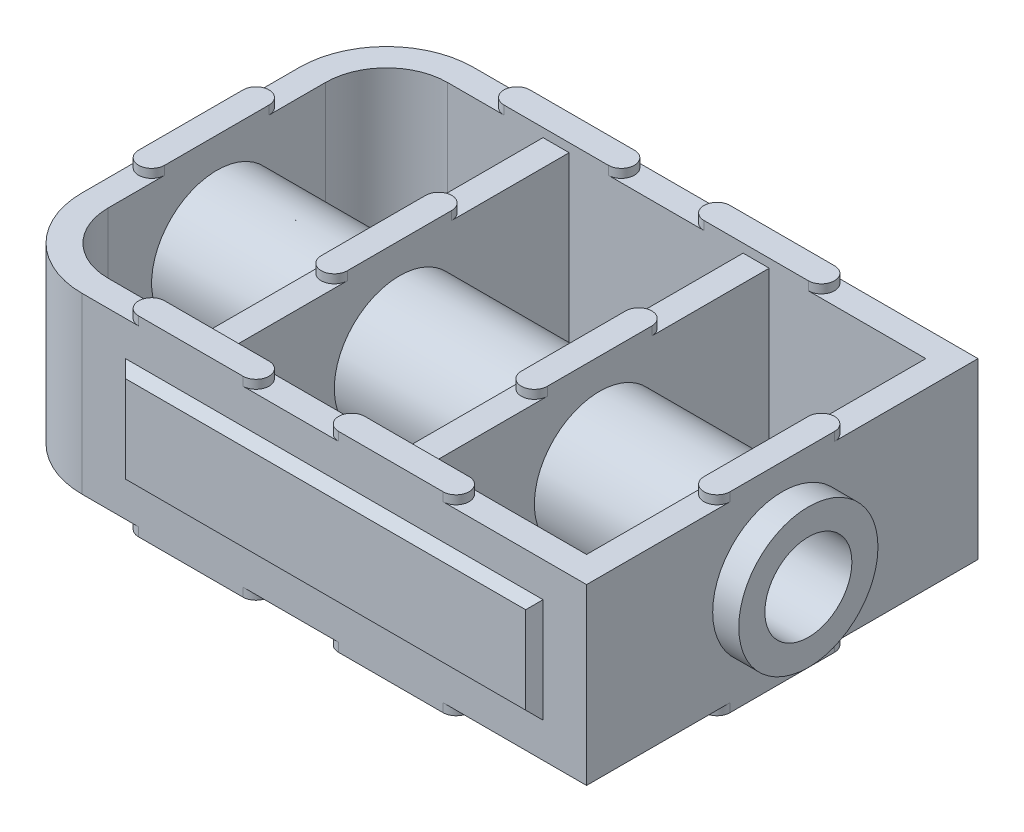
from build123d import *

# Parameters (mm, degrees)
SKETCH1_W                = 18
SKETCH1_H                = 39
SKETCH1_W_2              = 20
BOSS_EXTRUDE1_DEPTH      = 10
BOSS_EXTRUDE3_REACH      = 74.32
SKETCH3_R                = 7.5
SKETCH4_R                = 5
CUT_EXTRUDE1_DEPTH       = 68
CUT_EXTRUDE2_DEPTH       = 5
BOSS_EXTRUDE4_START      = 3
SKETCH6_R                = 8
SKETCH6_R_2              = 5
BOSS_EXTRUDE4_DEPTH      = 3
BOSS_EXTRUDE5_DEPTH      = 1
SKETCH8_W                = 48
SKETCH8_H                = 12
BOSS_EXTRUDE6_DEPTH      = 1
CHAMFER1_SIZE            = 1
CHAMFER1_OF_MIRROR2_SIZE = 1


with BuildPart() as part:
    # Sketch1 → Boss-Extrude1 (new, symmetric)
    with BuildSketch(Plane(origin=(0, 0, 0), x_dir=(1, 0, 0), z_dir=(0, 1, 0))):
        with BuildLine():
            Line((0, -22.5), (-58, -22.5))
            ThreePointArc((-58, -22.5), (-65.071067812, -19.571067812), (-68, -12.5))
            Line((-68, -12.5), (-68, 12.5))
            ThreePointArc((-68, 12.5), (-65.071067812, 19.571067812), (-58, 22.5))
            Line((-58, 22.5), (0, 22.5))
            Line((0, 22.5), (0, -22.5))
        make_face()
        with Locations((-12, 0)):
            Rectangle(SKETCH1_W, SKETCH1_H, mode=Mode.SUBTRACT)
        with BuildLine():
            Line((-65, -12.5), (-65, 12.5))
            ThreePointArc((-65, 12.5), (-62.949747468, 17.449747468), (-58, 19.5))
            Line((-58, 19.5), (-47, 19.5))
            Line((-47, 19.5), (-47, -19.5))
            Line((-47, -19.5), (-58, -19.5))
            ThreePointArc((-58, -19.5), (-62.949747468, -17.449747468), (-65, -12.5))
        make_face(mode=Mode.SUBTRACT)
        with Locations((-34, 0)):
            Rectangle(SKETCH1_W_2, SKETCH1_H, mode=Mode.SUBTRACT)
    extrude(amount=BOSS_EXTRUDE1_DEPTH, both=True)

    # Boss-Extrude3: up to this face of the body (flat: up to its plane)
    boss_extrude3_end = Plane(part.part.faces().sort_by_distance((-65, 0, 0))[0])
    # Sketch3 → Boss-Extrude3 (add, up to the picked face)
    with BuildSketch(Plane(origin=(0, 0, 0), x_dir=(0, 0, -1), z_dir=(1, 0, 0)), mode=Mode.PRIVATE) as boss_extrude3_sk1:
        Circle(SKETCH3_R)
    boss_extrude3_tool1 = split(extrude(boss_extrude3_sk1.sketch, amount=-BOSS_EXTRUDE3_REACH, mode=Mode.PRIVATE), bisect_by=boss_extrude3_end, keep=Keep.BOTH, mode=Mode.PRIVATE)
    add(boss_extrude3_tool1.solids().sort_by(Axis((0, 0, 0), (-1, 0, 0)))[0])

    # Sketch4 → Cut-Extrude1 (cut)
    with BuildSketch(Plane(origin=(0, 0, 0), x_dir=(0, 0, -1), z_dir=(1, 0, 0))):
        Circle(SKETCH4_R)
    extrude(amount=-CUT_EXTRUDE1_DEPTH, mode=Mode.SUBTRACT)

    # Sketch5 → Cut-Extrude2 (cut)
    with BuildSketch(Plane.ZY.offset(68)):
        Polygon((3.464101615, 6), (-3.464101615, 6), (-6.92820323, 0), (-3.464101615, -6), (3.464101615, -6), (6.92820323, 0), align=None)
    extrude(amount=-CUT_EXTRUDE2_DEPTH, mode=Mode.SUBTRACT)

    # Sketch6 → Boss-Extrude4 (add)
    with BuildSketch(Plane(origin=(0, 0, 0), x_dir=(0, 0, -1), z_dir=(1, 0, 0)).offset(BOSS_EXTRUDE4_START)):
        with Locations(Location((0, 0, 0), (0, 0, 180))):
            Circle(SKETCH6_R)
        Circle(SKETCH6_R_2, mode=Mode.SUBTRACT)
    extrude(amount=-BOSS_EXTRUDE4_DEPTH)

    # Sketch7 → Boss-Extrude5 (add)
    with BuildSketch(Plane(origin=(0, 10, 0), x_dir=(1, 0, 0), z_dir=(0, 1, 0))):
        with BuildLine():
            Line((-16.5, 19.5), (-28.5, 19.5))
            ThreePointArc((-28.5, 19.5), (-30, 21), (-28.5, 22.5))
            Line((-28.5, 22.5), (-16.5, 22.5))
            ThreePointArc((-16.5, 22.5), (-15, 21), (-16.5, 19.5))
        make_face()
        with BuildLine():
            Line((-51.5, 22.5), (-39.5, 22.5))
            ThreePointArc((-39.5, 22.5), (-38, 21), (-39.5, 19.5))
            Line((-39.5, 19.5), (-51.5, 19.5))
            ThreePointArc((-51.5, 19.5), (-53, 21), (-51.5, 22.5))
        make_face()
        with BuildLine():
            Line((-16.5, -19.5), (-28.5, -19.5))
            ThreePointArc((-28.5, -19.5), (-30, -21), (-28.5, -22.5))
            Line((-28.5, -22.5), (-16.5, -22.5))
            ThreePointArc((-16.5, -22.5), (-15, -21), (-16.5, -19.5))
        make_face()
        with BuildLine():
            Line((-51.5, -22.5), (-39.5, -22.5))
            ThreePointArc((-39.5, -22.5), (-38, -21), (-39.5, -19.5))
            Line((-39.5, -19.5), (-51.5, -19.5))
            ThreePointArc((-51.5, -19.5), (-53, -21), (-51.5, -22.5))
        make_face()
        with BuildLine():
            Line((-68, -6), (-68, 6))
            ThreePointArc((-68, 6), (-66.5, 7.5), (-65, 6))
            Line((-65, 6), (-65, -6))
            ThreePointArc((-65, -6), (-66.5, -7.5), (-68, -6))
        make_face()
        with BuildLine():
            Line((-24, -6), (-24, 6))
            ThreePointArc((-24, 6), (-22.5, 7.5), (-21, 6))
            Line((-21, 6), (-21, -6))
            ThreePointArc((-21, -6), (-22.5, -7.5), (-24, -6))
        make_face()
        with BuildLine():
            Line((-47, -6), (-47, 6))
            ThreePointArc((-47, 6), (-45.5, 7.5), (-44, 6))
            Line((-44, 6), (-44, -6))
            ThreePointArc((-44, -6), (-45.5, -7.5), (-47, -6))
        make_face()
        with BuildLine():
            Line((-3, -6), (-3, 6))
            ThreePointArc((-3, 6), (-1.5, 7.5), (0, 6))
            Line((0, 6), (0, -6))
            ThreePointArc((0, -6), (-1.5, -7.5), (-3, -6))
        make_face()
    boss_extrude5 = extrude(amount=BOSS_EXTRUDE5_DEPTH)

    # Mirror1: Boss-Extrude5 across plane
    add(boss_extrude5.mirror(Plane.ZX))

    # Sketch8 → Boss-Extrude6 (add)
    with BuildSketch(Plane.XY.offset(22.5)):
        with Locations((-29, 0)):
            Rectangle(SKETCH8_W, SKETCH8_H)
    boss_extrude6 = extrude(amount=BOSS_EXTRUDE6_DEPTH)

    # Chamfer1
    chamfer1_edges = [part.edges().sort_by_distance(p)[0] for p in [
        (-53, 0, 23.5),
        (-29, -6, 23.5),
        (-5, 0, 23.5),
        (-29, 6, 23.5),
    ]]
    chamfer(chamfer1_edges, length=CHAMFER1_SIZE - 0.0001)  # a hair under: the kernel refuses the full size

    # Mirror2: Boss-Extrude6 across plane
    add(boss_extrude6.mirror(Plane.XY))

    # Chamfer1 of Mirror2
    chamfer1_of_mirror2_edges = [part.edges().sort_by_distance(p)[0] for p in [
        (-53, 0, -23.5),
        (-29, -6, -23.5),
        (-5, 0, -23.5),
        (-29, 6, -23.5),
    ]]
    chamfer(chamfer1_of_mirror2_edges, length=CHAMFER1_OF_MIRROR2_SIZE - 0.0001)  # a hair under: the kernel refuses the full size


solid = part.part
